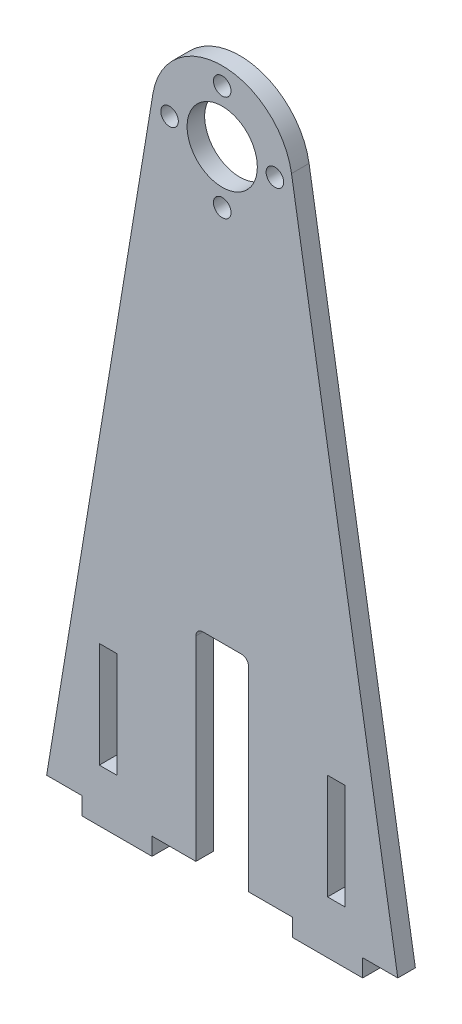
from build123d import *

# Parameters (mm, degrees)
SKETCH1_R           = 12.7
SKETCH1_R_2         = 3.175
SKETCH1_W           = 6.35
SKETCH1_H           = 38.1
BOSS_EXTRUDE1_DEPTH = 6.35
FILLET1_R           = 2.54
FILLET2_R           = 2.54


with BuildPart() as part:
    # Sketch1 → Boss-Extrude1 (new body)
    with BuildSketch(Plane.XY):
        with BuildLine():
            Line((25.4, 0), (9.525, 0))
            Line((9.525, 0), (9.525, 73.166345412))
            Line((9.525, 73.166345412), (-9.525, 73.166345412))
            Line((-9.525, 73.166345412), (-9.525, 0))
            Line((-9.525, 0), (-25.4, 0))
            Line((-25.4, 0), (-25.4, -6.35))
            Line((-25.4, -6.35), (-50.8, -6.35))
            Line((-50.8, -6.35), (-50.8, 0))
            Line((-50.8, 0), (-63.5, 0))
            Line((-63.5, 0), (-25.060495971, 232.739026659))
            ThreePointArc((-25.060495971, 232.739026659), (0, 254), (25.060495971, 232.739026659))
            Line((25.060495971, 232.739026659), (63.5, 0))
            Line((63.5, 0), (50.8, 0))
            Line((50.8, 0), (50.8, -6.35))
            Line((50.8, -6.35), (25.4, -6.35))
            Line((25.4, -6.35), (25.4, 0))
        make_face()
        with Locations((0, 228.6)):
            Circle(SKETCH1_R, mode=Mode.SUBTRACT)
        with Locations((0, 247.65)):
            Circle(SKETCH1_R_2, mode=Mode.SUBTRACT)
        with Locations((19.05, 228.6)):
            Circle(SKETCH1_R_2, mode=Mode.SUBTRACT)
        with Locations((0, 209.55)):
            Circle(SKETCH1_R_2, mode=Mode.SUBTRACT)
        with Locations((-19.05, 228.6)):
            Circle(SKETCH1_R_2, mode=Mode.SUBTRACT)
        with Locations((41.275, 31.75)):
            Rectangle(SKETCH1_W, SKETCH1_H, mode=Mode.SUBTRACT)
        with Locations((-41.275, 31.75)):
            Rectangle(SKETCH1_W, SKETCH1_H, mode=Mode.SUBTRACT)
    extrude(amount=BOSS_EXTRUDE1_DEPTH)

    # Fillet1
    fillet1_edges = [part.edges().sort_by_distance(p)[0] for p in [
        (-9.525, 73.166345412, 3.175),
    ]]
    fillet(fillet1_edges, radius=FILLET1_R)

    # Fillet2
    fillet2_edges = [part.edges().sort_by_distance(p)[0] for p in [
        (9.525, 73.166345412, 3.175),
    ]]
    fillet(fillet2_edges, radius=FILLET2_R)


solid = part.part
